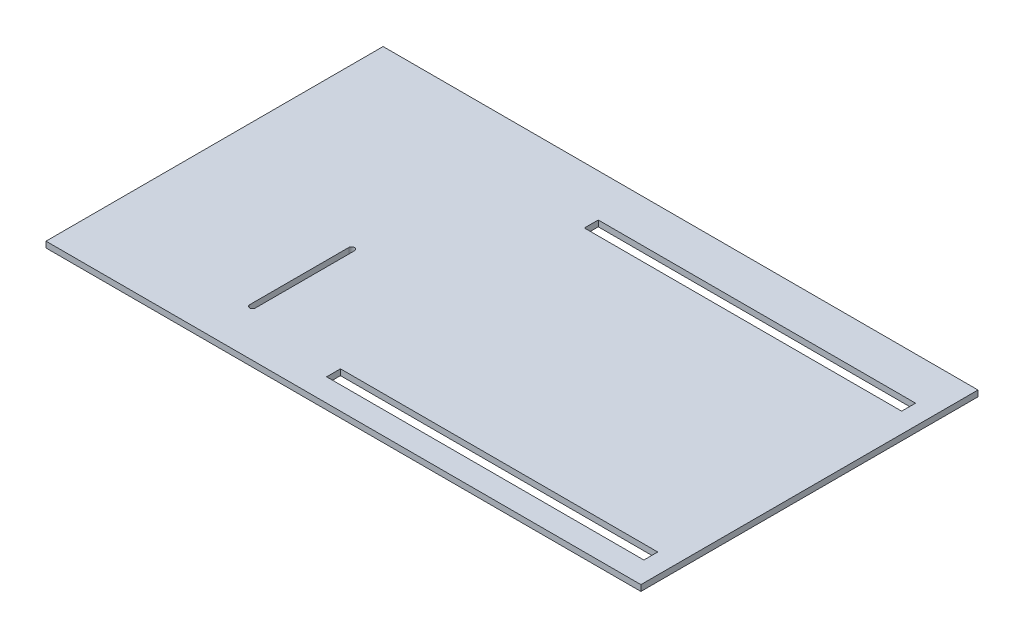
from build123d import *

# Parameters (mm, degrees)
SKETCH_1_W          = 300
SKETCH_1_H          = 170
EXTRUDE_1_DEPTH     = 3
CUT_EXTRUDE_1_DEPTH = 10
SKETCH_3_R          = 1.45
CUT_EXTRUDE_2_DEPTH = 10
SKETCH_4_W          = 160
SKETCH_4_H          = 7
CUT_EXTRUDE_3_DEPTH = 10


with BuildPart() as part:
    # 스케치1 → 보스-돌출1 (new body)
    with BuildSketch(Plane(origin=(0, 0, 0), x_dir=(1, 0, 0), z_dir=(0, 1, 0))):
        with Locations((150, 85)):
            Rectangle(SKETCH_1_W, SKETCH_1_H)
    extrude(amount=EXTRUDE_1_DEPTH)

    # 스케치2 → 컷-돌출1 (cut)
    with BuildSketch(Plane(origin=(0, 3, 0), x_dir=(1, 0, 0), z_dir=(0, 1, 0))):
        Polygon((79.1, 48.606579113), (79.1, 73.606579113), (82, 73.606579113), (82, 23.606579113), (79.1, 23.606579113), align=None)
    extrude(amount=-CUT_EXTRUDE_1_DEPTH, mode=Mode.SUBTRACT)

    # 스케치3 → 컷-돌출2 (cut)
    with BuildSketch(Plane(origin=(0, 3, 0), x_dir=(1, 0, 0), z_dir=(0, 1, 0))):
        with Locations((80.55, 73.606579113)):
            Circle(SKETCH_3_R)
        with Locations((80.55, 23.606579113)):
            Circle(SKETCH_3_R)
    extrude(amount=-CUT_EXTRUDE_2_DEPTH, mode=Mode.SUBTRACT)

    # 스케치4 → 컷-돌출3 (cut)
    with BuildSketch(Plane(origin=(0, 3, 0), x_dir=(1, 0, 0), z_dir=(0, 1, 0))):
        with Locations((210, 145)):
            Rectangle(SKETCH_4_W, SKETCH_4_H)
        with Locations((210, 15)):
            Rectangle(SKETCH_4_W, SKETCH_4_H)
    extrude(amount=-CUT_EXTRUDE_3_DEPTH, mode=Mode.SUBTRACT)


solid = part.part
